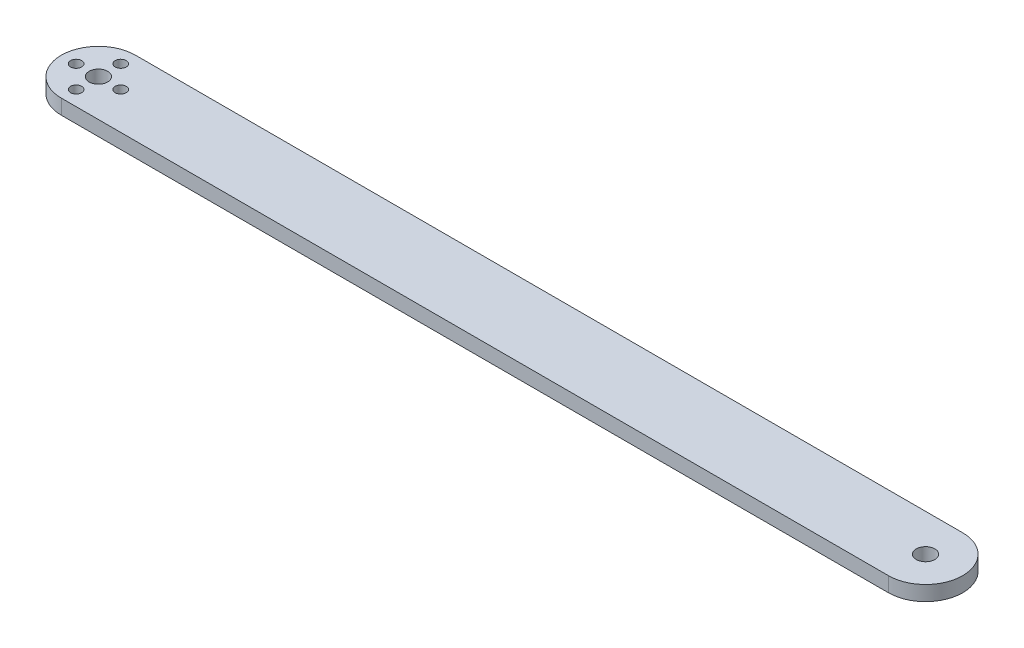
from build123d import *

# Parameters (mm, degrees)
SKETCH_1_R               = 2.5
EXTRUDE_1_DEPTH          = 4
SKETCH_2_R               = 1.5
CUT_EXTRUDE_1_DEPTH      = 4
PATTERN_CIRCULAR_1_COUNT = 4


with BuildPart() as part:
    # 草图1 → 凸台-拉伸1 (new body)
    with BuildSketch(Plane(origin=(0, 0, 0), x_dir=(1, 0, 0), z_dir=(0, 1, 0))):
        with BuildLine():
            Line((-111.375, 10), (111.375, 10))
            ThreePointArc((111.375, 10), (121.375, 0), (111.375, -10))
            Line((111.375, -10), (-111.375, -10))
            ThreePointArc((-111.375, -10), (-121.375, 0), (-111.375, 10))
        make_face()
        with Locations((-111.375, 0)):
            Circle(SKETCH_1_R, mode=Mode.SUBTRACT)
        with Locations((111.375, 0)):
            Circle(SKETCH_1_R, mode=Mode.SUBTRACT)
    extrude(amount=EXTRUDE_1_DEPTH)

    # 草图2 → 切除-拉伸1 (cut)
    with BuildSketch(Plane(origin=(0, 4, 0), x_dir=(1, 0, 0), z_dir=(0, 1, 0))):
        with Locations((-111.375, 6)):
            Circle(SKETCH_2_R)
    cut_extrude_1 = extrude(amount=-CUT_EXTRUDE_1_DEPTH, mode=Mode.SUBTRACT)

    # 阵列(圆周)1: 切除-拉伸1 ×4 about axis
    pattern_circular_1_axis = Axis((-111.375, 4, 0), (0, -1, 0))
    for i in range(1, PATTERN_CIRCULAR_1_COUNT):
        add(cut_extrude_1.rotate(pattern_circular_1_axis, i * 360 / PATTERN_CIRCULAR_1_COUNT), mode=Mode.SUBTRACT)


solid = part.part
